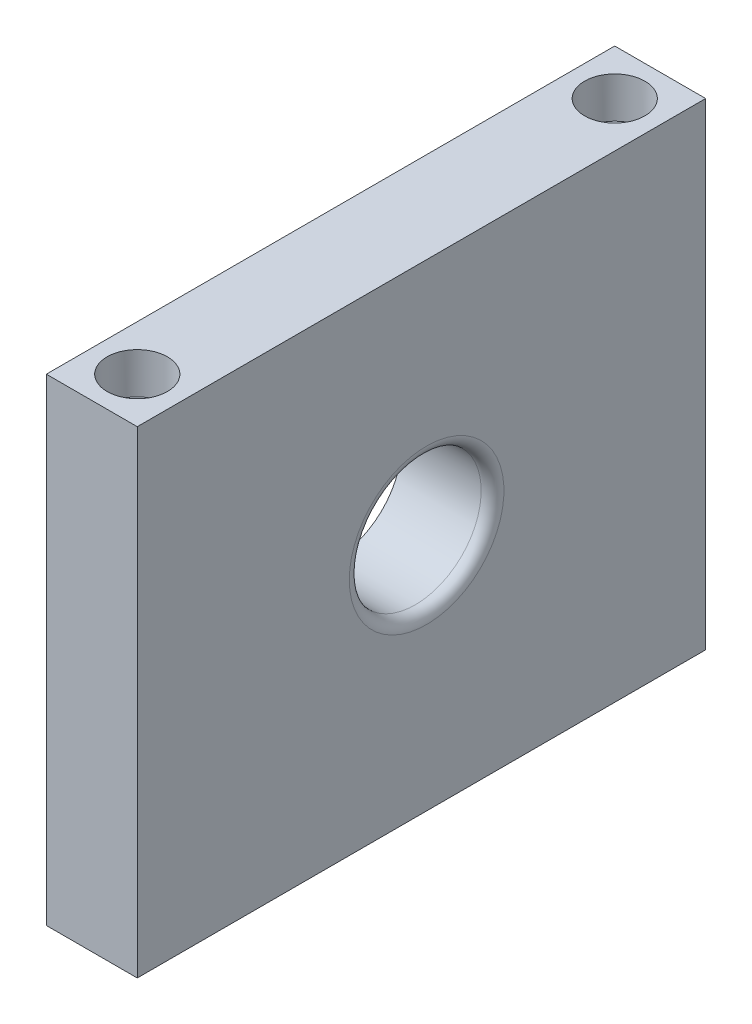
from build123d import *

# Parameters (mm, degrees)
SKETCH1_W           = 25
SKETCH1_H           = 50
SKETCH1_R           = 3.4
BOSS_EXTRUDE1_DEPTH = 3
SKETCH2_W           = 50
SKETCH2_H           = 3
BOSS_EXTRUDE2_DEPTH = 8
SKETCH3_W           = 8
SKETCH3_H           = 50
BOSS_EXTRUDE3_DEPTH = 42
SKETCH4_R           = 2.65
CUT_EXTRUDE1_DEPTH  = 6.6
SKETCH5_R           = 5.802370205
CUT_EXTRUDE2_DEPTH  = 9
FILLET2_R           = 1
SKETCH6_R           = 12.6
BOSS_EXTRUDE4_DEPTH = 2
FILLET4_R           = 1
SKETCH8_R           = 1.589780168
SKETCH8_R_2         = 1.777428262
CUT_EXTRUDE3_DEPTH  = 10
SKETCH9_W           = 49.021678163
SKETCH9_H           = 20.976854622
CUT_EXTRUDE4_DEPTH  = 68.79439129


with BuildPart() as part:
    # Sketch1 → Boss-Extrude1 (new body)
    with BuildSketch(Plane(origin=(0, 0, 0), x_dir=(1, 0, 0), z_dir=(0, 1, 0))):
        with Locations((2.276951673, 11.384758364)):
            Rectangle(SKETCH1_W, SKETCH1_H)
        with Locations(Location((1.276951673, 11.384758364, 0), (0, 0, 270))):
            Circle(SKETCH1_R, mode=Mode.SUBTRACT)
    extrude(amount=BOSS_EXTRUDE1_DEPTH)

    # Sketch2 → Boss-Extrude2 (add)
    with BuildSketch(Plane.ZY.offset(10.223048327)):
        with Locations((-11.384758364, 1.5)):
            Rectangle(SKETCH2_W, SKETCH2_H)
    extrude(amount=BOSS_EXTRUDE2_DEPTH)

    # Sketch3 → Boss-Extrude3 (add)
    with BuildSketch(Plane.XZ):
        with Locations((-14.223048327, -11.384758364)):
            Rectangle(SKETCH3_W, SKETCH3_H)
    extrude(amount=BOSS_EXTRUDE3_DEPTH)

    # Sketch4 → Cut-Extrude1 (cut)
    with BuildSketch(Plane(origin=(0, 3, 0), x_dir=(1, 0, 0), z_dir=(0, 1, 0))):
        with Locations(Location((-14.223048327, 32.384758364, 0), (0, 0, 270))):
            Circle(SKETCH4_R)
        with Locations(Location((-14.223048327, -9.615241636, 0), (0, 0, 270))):
            Circle(SKETCH4_R)
    cut_extrude1 = extrude(amount=-CUT_EXTRUDE1_DEPTH, mode=Mode.SUBTRACT)

    # Mirror1: Cut-Extrude1 across plane
    add(cut_extrude1.mirror(Plane.ZX.offset(-19.5)), mode=Mode.SUBTRACT)

    # Sketch5 → Cut-Extrude2 (cut)
    with BuildSketch(Plane.ZY.offset(18.223048327)):
        with Locations((-11.836279124, -21)):
            Circle(SKETCH5_R)
    extrude(amount=-CUT_EXTRUDE2_DEPTH, mode=Mode.SUBTRACT)

    # Fillet2
    fillet2_edges = [part.edges().sort_by_distance(p)[0] for p in [
        (-10.223048327, -21, -17.638649329),
    ]]
    fillet(fillet2_edges, radius=FILLET2_R)

    # Mirror2: Cut-Extrude1 across plane
    add(cut_extrude1.mirror(Plane.ZY.offset(1.723048327)), mode=Mode.SUBTRACT)

    # Sketch6 → Boss-Extrude4 (add)
    with BuildSketch(Plane(origin=(0, 3, 0), x_dir=(1, 0, 0), z_dir=(0, 1, 0))):
        with BuildLine():
            Line((14.776951673, 5.825082115), (14.776951673, 16.944434614))
            ThreePointArc((14.776951673, 16.944434614), (-13.323048327, 11.384758364), (14.776951673, 5.825082115))
        make_face()
        with Locations(Location((1.276951673, 11.384758364, 0), (0, 0, 270))):
            Circle(SKETCH6_R, mode=Mode.SUBTRACT)
    extrude(amount=BOSS_EXTRUDE4_DEPTH)

    # Fillet4
    # the kernel refuses this fillet: 1 mm, written as the material it takes off along each edge
    with BuildSketch(Plane(origin=(14.776951673, 5, -3.325082115), x_dir=(0, -1, 0), z_dir=(0, 0, -1))) as fillet4_piece_1:
        with BuildLine():
            CenterArc((FILLET4_R, FILLET4_R), FILLET4_R, 180, 90)
            Line((0, FILLET4_R), (0, 0))
            Line((0, 0), (FILLET4_R, 0))
        make_face()
    extrude(amount=16.119352499, mode=Mode.SUBTRACT)

    # Sketch8 → Cut-Extrude3 (cut)
    with BuildSketch(Plane(origin=(0, 3, 0), x_dir=(1, 0, 0), z_dir=(0, 1, 0))):
        with Locations(Location((1.276951673, 19.884758364, 0), (0, 0, 270))):
            Circle(SKETCH8_R)
        with Locations(Location((1.276951673, 2.884758364, 0), (0, 0, 270))):
            Circle(SKETCH8_R_2)
    extrude(amount=-CUT_EXTRUDE3_DEPTH, mode=Mode.SUBTRACT)

    # Sketch9 → Cut-Extrude4 (cut, through all)
    with BuildSketch(Plane.XY.offset(13.615241636)):
        with Locations((-9.733887409, 10.488427311)):
            Rectangle(SKETCH9_W, SKETCH9_H)
    extrude(amount=-CUT_EXTRUDE4_DEPTH, mode=Mode.SUBTRACT)


solid = part.part
